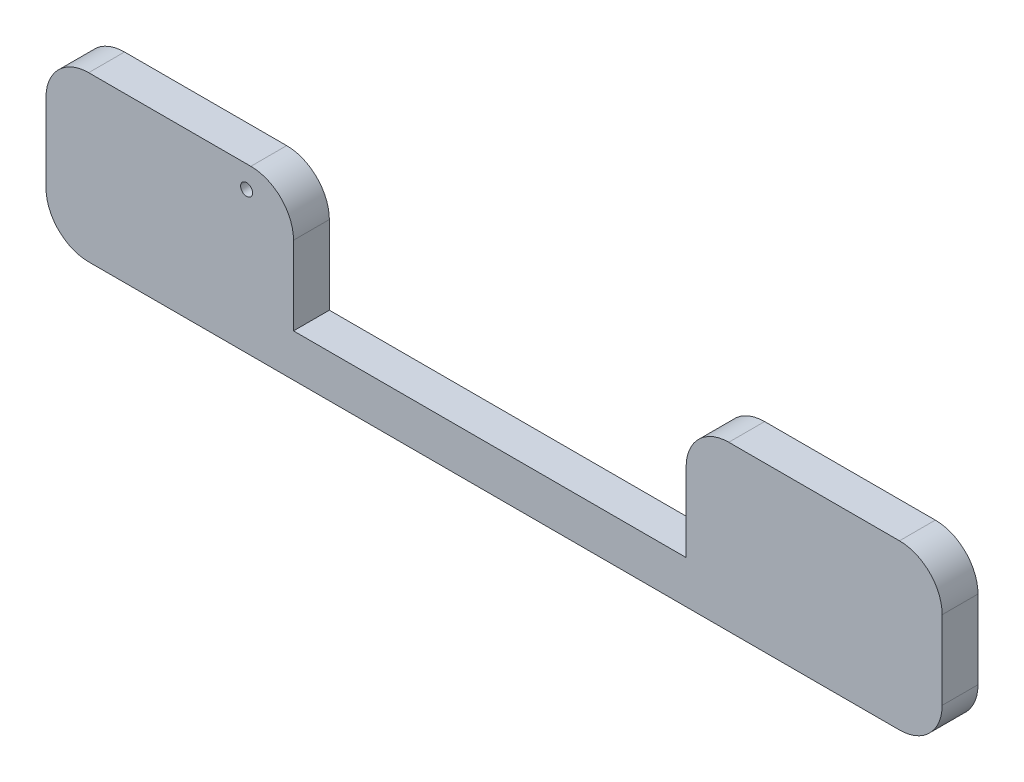
from build123d import *

# Parameters (mm, degrees)
SKETCH1_W           = 133.35
SKETCH1_H           = 24.384
BOSS_EXTRUDE1_DEPTH = 5.334
SKETCH3_W           = 58.42
SKETCH3_H           = 18.034
CUT_EXTRUDE1_DEPTH  = 104.917980915
FILLET1_R           = 6.35
SKETCH4_R           = 0.889
CUT_EXTRUDE2_DEPTH  = 104.917980915


with BuildPart() as part:
    # Sketch1 → Boss-Extrude1 (new body)
    with BuildSketch(Plane.XY):
        with Locations((-18.387445418, -47.262819662)):
            Rectangle(SKETCH1_W, SKETCH1_H)
    extrude(amount=BOSS_EXTRUDE1_DEPTH)

    # Sketch3 → Cut-Extrude1 (cut, through all)
    with BuildSketch(Plane.XY.offset(5.334)):
        with Locations((-19.022445418, -44.087819662)):
            Rectangle(SKETCH3_W, SKETCH3_H)
    extrude(amount=-CUT_EXTRUDE1_DEPTH, mode=Mode.SUBTRACT)

    # Fillet1
    fillet1_edges = [part.edges().sort_by_distance(p)[0] for p in [
        (-85.062445418, -35.070819662, 2.667),
        (-48.232445418, -35.070819662, 2.667),
        (10.187554582, -35.070819662, 2.667),
        (48.287554582, -35.070819662, 2.667),
        (48.287554582, -59.454819662, 2.667),
        (-85.062445418, -59.454819662, 2.667),
    ]]
    fillet(fillet1_edges, radius=FILLET1_R)

    # Sketch4 → Cut-Extrude2 (cut, through all)
    with BuildSketch(Plane.XY.offset(5.334)):
        with Locations((-55.217445418, -38.372819662)):
            Circle(SKETCH4_R)
    extrude(amount=-CUT_EXTRUDE2_DEPTH, mode=Mode.SUBTRACT)


solid = part.part
